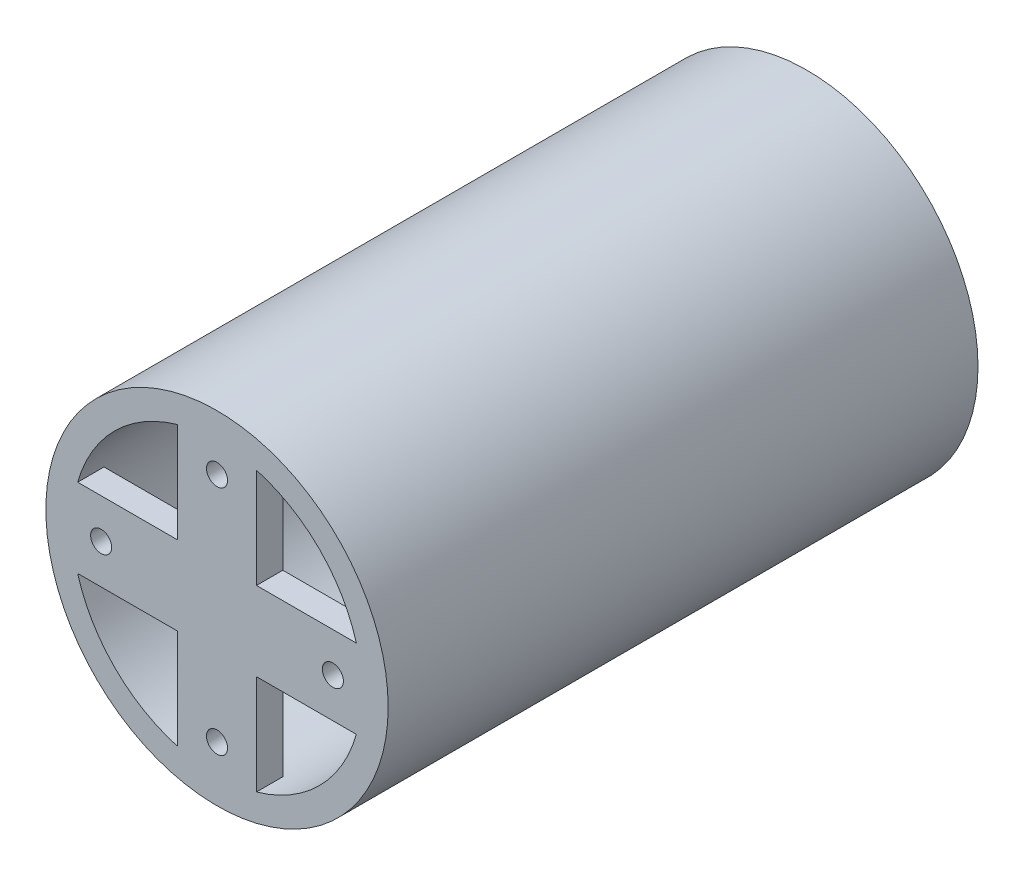
from build123d import *

# Parameters (mm, degrees)
CROQUIS1_R          = 32.5
CROQUIS1_R_2        = 27.5
BOSS_EXTRUDE1_DEPTH = 112
SKETCH1_R           = 1.5
CUT_EXTRUDE1_DEPTH  = 5
SKETCH2_R           = 2
BOSS_EXTRUDE2_DEPTH = 5


with BuildPart() as part:
    # Croquis1 → Boss-Extrude1 (new body)
    with BuildSketch(Plane.XY):
        Circle(CROQUIS1_R)
        Circle(CROQUIS1_R_2, mode=Mode.SUBTRACT)
    extrude(amount=BOSS_EXTRUDE1_DEPTH)

    # Sketch1 → Cut-Extrude1 (cut)
    with BuildSketch(Plane(origin=(0, 0, 0), x_dir=(-1, 0, 0), z_dir=(0, 0, -1))):
        with Locations((-30, 0)):
            Circle(SKETCH1_R)
        with Locations((0, 30)):
            Circle(SKETCH1_R)
        with Locations((30, 0)):
            Circle(SKETCH1_R)
        with Locations((0, -30)):
            Circle(SKETCH1_R)
    extrude(amount=-CUT_EXTRUDE1_DEPTH, mode=Mode.SUBTRACT)

    # Sketch2 → Boss-Extrude2 (add)
    with BuildSketch(Plane.XY.offset(112)):
        Polygon((-30, 7.5), (-30, -7.5), (-7.5, -7.5), (-7.5, -30), (7.5, -30), (7.5, -7.5), (30, -7.5), (30, 7.5), (7.5, 7.5), (7.5, 30), (-7.5, 30), (-7.5, 7.5), align=None)
        with Locations((-22, 0)):
            Circle(SKETCH2_R, mode=Mode.SUBTRACT)
        with Locations((0, 22)):
            Circle(SKETCH2_R, mode=Mode.SUBTRACT)
        with Locations((22, 0)):
            Circle(SKETCH2_R, mode=Mode.SUBTRACT)
        with Locations((0, -22)):
            Circle(SKETCH2_R, mode=Mode.SUBTRACT)
    extrude(amount=-BOSS_EXTRUDE2_DEPTH)


solid = part.part
